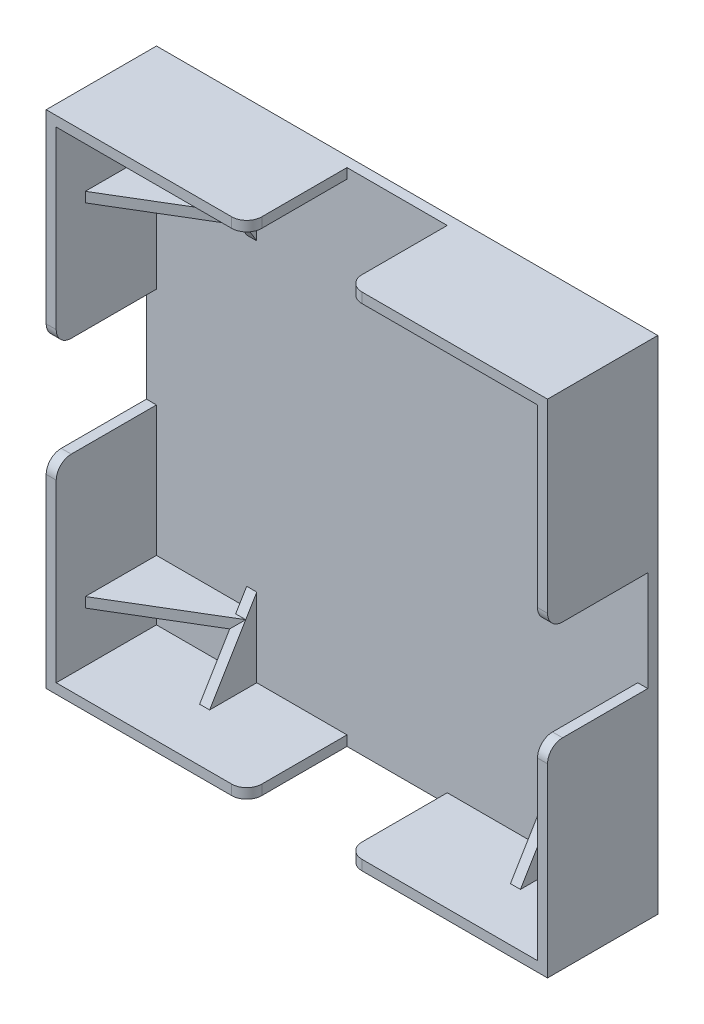
from build123d import *

# Parameters (mm, degrees)
SKETCH_1_W          = 100
SKETCH_1_H          = 100
EXTRUDE_1_DEPTH     = 2
SKETCH_2_W          = 2
SKETCH_2_H          = 2
SKETCH_2_W_2        = 38
SKETCH_2_H_2        = 38
EXTRUDE_2_DEPTH     = 20
SKETCH_3_W          = 38
SKETCH_3_H          = 2
SKETCH_3_W_2        = 2
SKETCH_3_H_2        = 38
SKETCH_3_H_3        = 40
SKETCH_3_W_3        = 40
EXTRUDE_3_DEPTH     = 20
RIB_2_REACH         = 133.807
SKETCH_7_WALL_W     = 294.768112702
SKETCH_7_WALL_H     = 2
FILLET_1_R          = 3
RIB_3_REACH         = 133.807
SKETCH_8_WALL_W     = 294.768112702
SKETCH_8_WALL_H     = 2
MIRROR_START        = 20
MIRROR_3_DEPTH      = 2
MIRROR_START_2      = 82
MIRROR_3_2_DEPTH    = 2
MIRROR_START_3      = 2
MIRROR_3_3_DEPTH    = 18
MIRROR_START_4      = 84
MIRROR_3_4_DEPTH    = 14
MIRROR_START_5      = 12
MIRROR_3_5_DEPTH    = 2
SKETCH_10_R         = 2
CUT_EXTRUDE_1_DEPTH = 20
SKETCH_11_R         = 2
CUT_EXTRUDE_2_DEPTH = 20


with BuildPart() as part:
    # 草图1 → 凸台-拉伸1 (new body)
    with BuildSketch(Plane.XY):
        with Locations((50, 50)):
            Rectangle(SKETCH_1_W, SKETCH_1_H)
    extrude(amount=EXTRUDE_1_DEPTH)

    # 草图2 → 凸台-拉伸2 (add)
    with BuildSketch(Plane.XY.offset(2)):
        with Locations((1, 99)):
            Rectangle(SKETCH_2_W, SKETCH_2_H)
        with Locations((21, 99)):
            Rectangle(SKETCH_2_W_2, SKETCH_2_H)
        with Locations((1, 79)):
            Rectangle(SKETCH_2_W, SKETCH_2_H_2)
        with Locations((1, 21)):
            Rectangle(SKETCH_2_W, SKETCH_2_H_2)
        with Locations((1, 1)):
            Rectangle(SKETCH_2_W, SKETCH_2_H)
        with Locations((21, 1)):
            Rectangle(SKETCH_2_W_2, SKETCH_2_H)
    extrude(amount=EXTRUDE_2_DEPTH)

    # 草图3 → 凸台-拉伸3 (add)
    with BuildSketch(Plane.XY.offset(2)):
        with Locations((79, 99)):
            Rectangle(SKETCH_3_W, SKETCH_3_H)
        with Locations((99, 99)):
            Rectangle(SKETCH_3_W_2, SKETCH_3_H)
        with Locations((99, 79)):
            Rectangle(SKETCH_3_W_2, SKETCH_3_H_2)
        with Locations((99, 20)):
            Rectangle(SKETCH_3_W_2, SKETCH_3_H_3)
        with Locations((80, 1)):
            Rectangle(SKETCH_3_W_3, SKETCH_3_H)
    extrude(amount=EXTRUDE_3_DEPTH)

    # 草图7 wall → 筋2 (add, up to next)
    with BuildSketch(Plane(origin=(87.5, 83, 7.5), x_dir=(-0.857492925713, 0, -0.514495755428), z_dir=(0.514495755428, 0, -0.857492925713)), mode=Mode.PRIVATE) as rib_2_sk1:
        Rectangle(SKETCH_7_WALL_W, SKETCH_7_WALL_H)
    rib_2_tool1 = extrude(rib_2_sk1.sketch, amount=RIB_2_REACH, mode=Mode.PRIVATE) - part.part
    rib_2 = rib_2_tool1.solids().sort_by_distance((87.5, 83, 7.5))[0]
    add(rib_2)

    # 圆角1
    fillet_1_edges = [part.edges().sort_by_distance(p)[0] for p in [
        (40, 1, 22),
        (1, 40, 22),
        (1, 60, 22),
        (40, 99, 22),
        (99, 60, 22),
        (60, 99, 22),
        (99, 40, 22),
        (60, 1, 22),
    ]]
    fillet(fillet_1_edges, radius=FILLET_1_R)

    # 草图8 wall → 筋3 (add, up to next)
    with BuildSketch(Plane(origin=(83, 87.5, 7.5), x_dir=(0, 0.857492925713, 0.514495755428), z_dir=(0, 0.514495755428, -0.857492925713)), mode=Mode.PRIVATE) as rib_3_sk1:
        Rectangle(SKETCH_8_WALL_W, SKETCH_8_WALL_H)
    rib_3_tool1 = extrude(rib_3_sk1.sketch, amount=RIB_3_REACH, mode=Mode.PRIVATE) - part.part
    rib_3 = rib_3_tool1.solids().sort_by_distance((83, 87.5, 7.5))[0]
    add(rib_3)

    # 镜向1: 筋3 mirrored; each copy of 筋3 runs up to whatever stops it at its own place
    mirror_1_before = part.part  # the part as the pattern finds it: every copy runs up to it
    mirror_1_rib_3_long = extrude(rib_3_sk1.sketch, amount=RIB_3_REACH, mode=Mode.PRIVATE)
    mirror_1_rib_3_tool1 = mirror_1_rib_3_long.mirror(Plane(origin=(52, 0, 0), x_dir=(0, 0, 1), z_dir=(1, 0, 0))) - mirror_1_before
    add(mirror_1_rib_3_tool1.solids().sort_by_distance((21, 87.5, 7.5))[0])

    # 镜向2: 筋2 mirrored; each copy of 筋2 runs up to whatever stops it at its own place
    mirror_2_before = part.part  # the part as the pattern finds it: every copy runs up to it
    mirror_2_rib_2_long = extrude(rib_2_sk1.sketch, amount=RIB_2_REACH, mode=Mode.PRIVATE)
    mirror_2_rib_2_tool1 = mirror_2_rib_2_long.mirror(Plane(origin=(52, 0, 0), x_dir=(0, 0, 1), z_dir=(1, 0, 0))) - mirror_2_before
    add(mirror_2_rib_2_tool1.solids().sort_by_distance((16.5, 83, 7.5))[0])

    # 镜向3: read off the stored shape, not the designer's step
    # 镜向3 outline → 镜向3 (add)
    with BuildSketch(Plane.YZ.offset(MIRROR_START)):
        Polygon((17.666666667, 2), (14, 4.2), (2, 11.4), (2, 2), align=None)
    extrude(amount=MIRROR_3_DEPTH)

    # Mirror 3 2 outline → Mirror 3 2 (add)
    with BuildSketch(Plane.YZ.offset(MIRROR_START_2)):
        Polygon((14, 2), (14, 4.2), (2, 11.4), (2, 2), align=None)
    extrude(amount=MIRROR_3_2_DEPTH)

    # Mirror 3 3 outline → Mirror 3 3 (add)
    with BuildSketch(Plane.YZ.offset(MIRROR_START_3)):
        Polygon((14, 2), (14, 4.2), (12, 5.4), (12, 2), align=None)
    extrude(amount=MIRROR_3_3_DEPTH)

    # Mirror 3 4 outline → Mirror 3 4 (add)
    with BuildSketch(Plane.YZ.offset(MIRROR_START_4)):
        Polygon((14, 2), (14, 4.2), (12, 5.4), (12, 2), align=None)
    extrude(amount=MIRROR_3_4_DEPTH)

    # Mirror 3 5 outline → Mirror 3 5 (add)
    with BuildSketch(Plane(origin=(0, 0, 0), x_dir=(1, 0, 0), z_dir=(0, 1, 0)).offset(MIRROR_START_5)):
        Polygon((98, -13.8), (98, -2), (78.333333333, -2), align=None)
        Polygon((2, -16.2), (22, -4.2), (20, -4.2), (20, -2), (2, -2), align=None)
    extrude(amount=MIRROR_3_5_DEPTH)

    # 草图10 → 切除-拉伸1 (cut)
    with BuildSketch(Plane.XY.offset(2)):
        with Locations((90, 90)):
            Circle(SKETCH_10_R)
    extrude(amount=-CUT_EXTRUDE_1_DEPTH, mode=Mode.SUBTRACT)

    # 草图11 → 切除-拉伸2 (cut)
    with BuildSketch(Plane.XY.offset(2)):
        with Locations((10, 10)):
            Circle(SKETCH_11_R)
    extrude(amount=-CUT_EXTRUDE_2_DEPTH, mode=Mode.SUBTRACT)


solid = part.part
